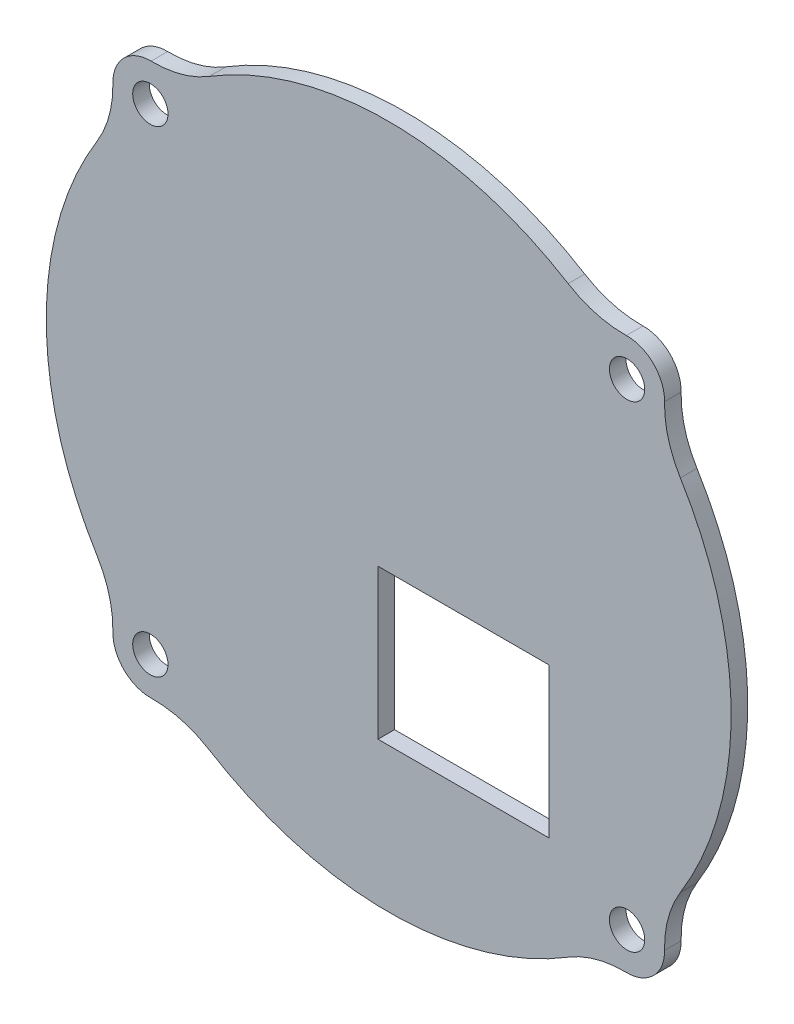
from build123d import *

# Parameters (mm, degrees)
ESQUISSE1_R             = 1.65
BOSS_EXTRU_1_DEPTH      = 1.55
ESQUISSE3_W             = 14
ESQUISSE3_H             = 8
ENL_V_MAT_EXTRU_1_DEPTH = 46.281370341
ESQUISSE4_W             = 16
ESQUISSE4_H             = 8
ENL_V_MAT_EXTRU_2_DEPTH = 1.55
ESQUISSE5_W             = 2
ESQUISSE5_H             = 6
ENL_V_MAT_EXTRU_3_DEPTH = 1.55
CONG_1_R                = 10


with BuildPart() as part:
    # Esquisse1 → Boss.-Extru.1 (new body)
    with BuildSketch(Plane.XY):
        with BuildLine():
            ThreePointArc((-24.957906965, 20.02755302), (-32, 0), (-24.957906965, -20.02755302))
            ThreePointArc((-24.957906965, -20.02755302), (-24.748737342, -24.748737342), (-20.02755302, -24.957906965))
            ThreePointArc((-20.02755302, -24.957906965), (0, -32), (20.02755302, -24.957906965))
            ThreePointArc((20.02755302, -24.957906965), (24.748737342, -24.748737342), (24.957906965, -20.02755302))
            ThreePointArc((24.957906965, -20.02755302), (32, 0), (24.957906965, 20.02755302))
            ThreePointArc((24.957906965, 20.02755302), (24.748737342, 24.748737342), (20.02755302, 24.957906965))
            ThreePointArc((20.02755302, 24.957906965), (0, 32), (-20.02755302, 24.957906965))
            ThreePointArc((-20.02755302, 24.957906965), (-24.748737342, 24.748737342), (-24.957906965, 20.02755302))
        make_face()
        with Locations((-22.273863607, 22.273863607)):
            Circle(ESQUISSE1_R, mode=Mode.SUBTRACT)
        with Locations((22.273863607, 22.273863607)):
            Circle(ESQUISSE1_R, mode=Mode.SUBTRACT)
        with Locations((22.273863607, -22.273863607)):
            Circle(ESQUISSE1_R, mode=Mode.SUBTRACT)
        with Locations((-22.273863607, -22.273863607)):
            Circle(ESQUISSE1_R, mode=Mode.SUBTRACT)
    extrude(amount=BOSS_EXTRU_1_DEPTH)

    # Esquisse3 → Enlèv. mat.-Extru.1 (cut, through all)
    with BuildSketch(Plane.XY.offset(1.55)):
        with Locations((6, -14.5)):
            Rectangle(ESQUISSE3_W, ESQUISSE3_H)
    extrude(amount=-ENL_V_MAT_EXTRU_1_DEPTH, mode=Mode.SUBTRACT)

    # Esquisse4 → Enlèv. mat.-Extru.2 (cut)
    with BuildSketch(Plane.XY.offset(1.55)):
        with Locations((7, -8.5)):
            Rectangle(ESQUISSE4_W, ESQUISSE4_H)
    extrude(amount=-ENL_V_MAT_EXTRU_2_DEPTH, mode=Mode.SUBTRACT)

    # Esquisse5 → Enlèv. mat.-Extru.3 (cut)
    with BuildSketch(Plane.XY.offset(1.55)):
        with Locations((14, -15.5)):
            Rectangle(ESQUISSE5_W, ESQUISSE5_H)
    extrude(amount=-ENL_V_MAT_EXTRU_3_DEPTH, mode=Mode.SUBTRACT)

    # Congé1
    cong_1_edges = [part.edges().sort_by_distance(p)[0] for p in [
        (24.957906965, -20.02755302, 0.775),
        (20.02755302, -24.957906965, 0.775),
        (-20.02755302, -24.957906965, 0.775),
        (-24.957906965, -20.02755302, 0.775),
        (-24.957906965, 20.02755302, 0.775),
        (-20.02755302, 24.957906965, 0.775),
        (20.02755302, 24.957906965, 0.775),
        (24.957906965, 20.02755302, 0.775),
    ]]
    fillet(cong_1_edges, radius=CONG_1_R)


solid = part.part
